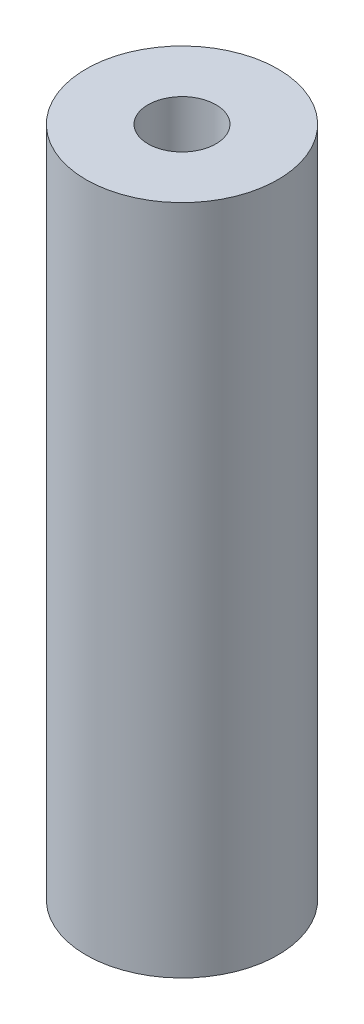
from build123d import *

# Parameters (mm, degrees)
SKETCH1_R             = 6.35
BOSS_EXTRUDE1_DEPTH   = 44.45
F_8_CLEARANCE_HOLE1_D = 4.4958


with BuildPart() as part:
    # Sketch1 → Boss-Extrude1 (new body)
    with BuildSketch(Plane(origin=(0, 0, 0), x_dir=(1, 0, 0), z_dir=(0, 1, 0))):
        Circle(SKETCH1_R)
    extrude(amount=BOSS_EXTRUDE1_DEPTH)

    # #8 Clearance Hole1 (through all)
    with Locations(Plane(origin=(0, 44.45, 0), x_dir=(1, 0, 0), z_dir=(0, 1, 0))):
        with Locations((0, 0)):
            Hole(F_8_CLEARANCE_HOLE1_D / 2)


solid = part.part
